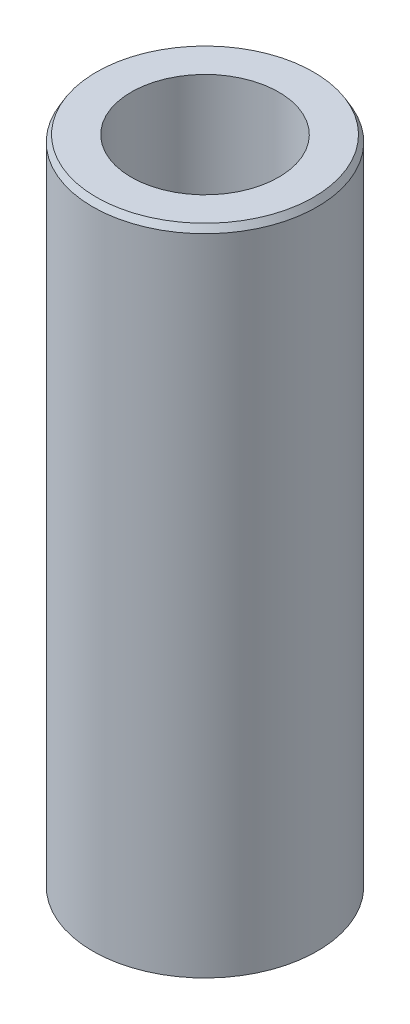
from build123d import *
from OCP.BRepFilletAPI import BRepFilletAPI_MakeChamfer

# Parameters (mm, degrees)
SKETCH1_R           = 10
BOSS_EXTRUDE1_DEPTH = 58.31540744
SKETCH2_R           = 6.570911812
CUT_EXTRUDE1_DEPTH  = 61.005722601
CHAMFER1_SIZE       = 0.573514331
CHAMFER1_SIZE2      = 0.331118653


with BuildPart() as part:
    # Sketch1 → Boss-Extrude1 (new body)
    with BuildSketch(Plane(origin=(0, 0, 0), x_dir=(1, 0, 0), z_dir=(0, 1, 0))):
        Circle(SKETCH1_R)
    extrude(amount=BOSS_EXTRUDE1_DEPTH)

    # Sketch2 → Cut-Extrude1 (cut, through all)
    with BuildSketch(Plane(origin=(0, 0, 0), x_dir=(1, 0, 0), z_dir=(0, 1, 0))):
        Circle(SKETCH2_R)
    extrude(amount=CUT_EXTRUDE1_DEPTH, mode=Mode.SUBTRACT)

    # Chamfer1: one chamfer whose edges measure the first distance from different faces: ONE call of the kernel's chamfer builder (chamfer() names one face for all edges)
    chamfer1_edges_1 = [part.edges().sort_by_distance(p)[0] for p in [
        (-10, 58.31540744, 0),
    ]]
    chamfer1_side_1 = [part.faces().sort_by_distance(p)[0] for p in [
        (-10, 29.15770372, 0),
    ]]
    chamfer1_edges_2 = [part.edges().sort_by_distance(p)[0] for p in [
        (-10, 0, 0),
    ]]
    chamfer1_side_2 = [part.faces().sort_by_distance(p)[0] for p in [
        (-9.717157288, 0, 0),
    ]]
    chamfer1 = BRepFilletAPI_MakeChamfer(part.part.solid().wrapped)
    for e in chamfer1_edges_1:
        chamfer1.Add(CHAMFER1_SIZE, CHAMFER1_SIZE2, e.wrapped, chamfer1_side_1[0].wrapped)  # the first distance lies on this face
    for e in chamfer1_edges_2:
        chamfer1.Add(CHAMFER1_SIZE, CHAMFER1_SIZE2, e.wrapped, chamfer1_side_2[0].wrapped)  # the first distance lies on this face
    add(Compound.cast(chamfer1.Shape()), mode=Mode.REPLACE)


solid = part.part
